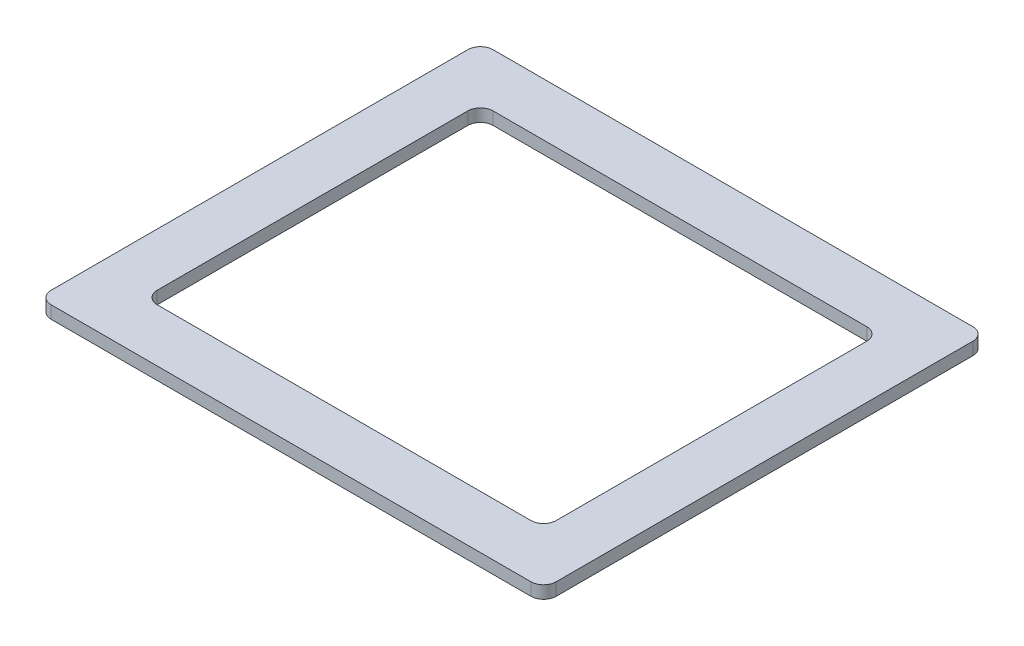
from build123d import *

# Parameters (mm, degrees)
SKETCH1_W           = 400
SKETCH1_H           = 350
BOSS_EXTRUDE1_DEPTH = 10
SKETCH2_W           = 316
SKETCH2_H           = 266
CUT_EXTRUDE1_DEPTH  = 266.941722939
FILLET1_R           = 10


with BuildPart() as part:
    # Sketch1 → Boss-Extrude1 (new body)
    with BuildSketch(Plane(origin=(0, 0, 0), x_dir=(1, 0, 0), z_dir=(0, 1, 0))):
        Rectangle(SKETCH1_W, SKETCH1_H)
    extrude(amount=BOSS_EXTRUDE1_DEPTH)

    # Sketch2 → Cut-Extrude1 (cut, through all)
    with BuildSketch(Plane(origin=(0, 10, 0), x_dir=(1, 0, 0), z_dir=(0, 1, 0))):
        Rectangle(SKETCH2_W, SKETCH2_H)
    extrude(amount=-CUT_EXTRUDE1_DEPTH, mode=Mode.SUBTRACT)

    # Fillet1
    fillet1_edges = [part.edges().sort_by_distance(p)[0] for p in [
        (-158, 5, -133),
        (200, 5, -175),
        (-158, 5, 133),
        (158, 5, 133),
        (200, 5, 175),
        (158, 5, -133),
        (-200, 5, -175),
        (-200, 5, 175),
    ]]
    fillet(fillet1_edges, radius=FILLET1_R)


solid = part.part
